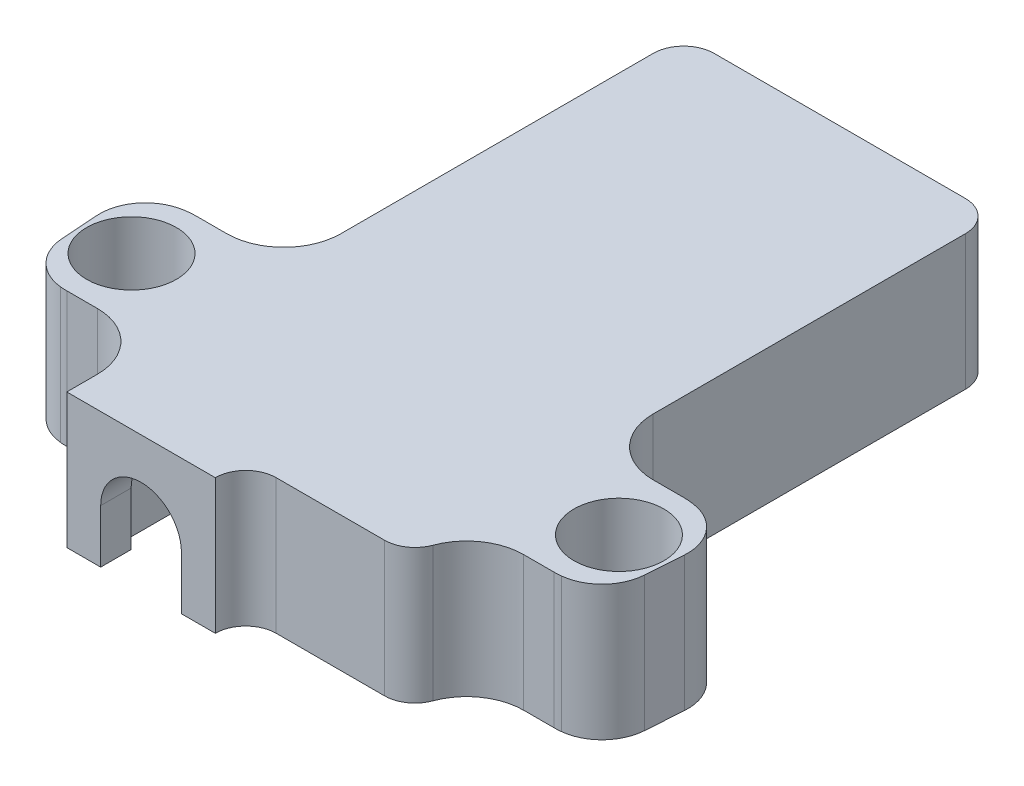
from build123d import *

# Parameters (mm, degrees)
SKETCH1_W           = 20.5
SKETCH1_H           = 38.5
SKETCH1_R           = 4.25
SKETCH1_R_2         = 1.75
BOSS_EXTRUDE1_DEPTH = 1.5
SKETCH2_W           = 20.5
SKETCH2_H           = 38.5
BOSS_EXTRUDE2_DEPTH = 7.35
SKETCH3_W           = 17.5
SKETCH3_H           = 35.5
SKETCH3_W_2         = 6.75
SKETCH3_H_2         = 1.5
CUT_EXTRUDE1_DEPTH  = 7.35
SKETCH4_W           = 7.2
SKETCH4_H           = 1.5
CUT_EXTRUDE2_DEPTH  = 4.05
SKETCH6_W           = 17.5
SKETCH6_H           = 1.5
BOSS_EXTRUDE3_DEPTH = 1.35
SKETCH7_W           = 3.5
SKETCH7_H           = 2
BOSS_EXTRUDE4_DEPTH = 1
SKETCH8_R           = 2.95
BOSS_EXTRUDE5_DEPTH = 7.35
FILLET2_R           = 3.75
CUT_EXTRUDE4_START  = -8.85
CUT_EXTRUDE4_DEPTH  = 8.85
FILLET5_R           = 3
SKETCH10_W          = 9.75
SKETCH10_H          = 2
BOSS_EXTRUDE6_DEPTH = 8.85
CUT_EXTRUDE5_REACH  = 47.729
FILLET4_R           = 2


with BuildPart() as part:
    # Sketch1 → Boss-Extrude1 (new body)
    # profile 1 of 5: a face of its own
    with BuildSketch(Plane(origin=(0, 0, 0), x_dir=(1, 0, 0), z_dir=(0, 1, 0))):
        with Locations((0, 11.25)):
            Rectangle(SKETCH1_W, SKETCH1_H)
    # profile 2 of 5: a face of its own
    with BuildSketch(Plane(origin=(0, 0, 0), x_dir=(1, 0, 0), z_dir=(0, 1, 0))):
        with BuildLine():
            Line((-10.25, -4.25), (-10.25, 4.25))
            Line((-10.25, 4.25), (-16, 4.25))
            ThreePointArc((-16, 4.25), (-12.99479618, 3.00520382), (-11.75, 0))
            ThreePointArc((-11.75, 0), (-12.99479618, -3.00520382), (-16, -4.25))
            Line((-16, -4.25), (-10.25, -4.25))
        make_face()
    # profile 3 of 5: a face of its own
    with BuildSketch(Plane(origin=(0, 0, 0), x_dir=(1, 0, 0), z_dir=(0, 1, 0))):
        with Locations((-16, 0)):
            Circle(SKETCH1_R)
        with Locations(Location((-16, 0, 0), (0, 0, 270))):
            Circle(SKETCH1_R_2, mode=Mode.SUBTRACT)
    # profile 4 of 5: a face of its own
    with BuildSketch(Plane(origin=(0, 0, 0), x_dir=(1, 0, 0), z_dir=(0, 1, 0))):
        with BuildLine():
            Line((16, 4.25), (10.25, 4.25))
            Line((10.25, 4.25), (10.25, -4.25))
            Line((10.25, -4.25), (16, -4.25))
            ThreePointArc((16, -4.25), (11.75, 0), (16, 4.25))
        make_face()
    # profile 5 of 5: a face of its own
    with BuildSketch(Plane(origin=(0, 0, 0), x_dir=(1, 0, 0), z_dir=(0, 1, 0))):
        with Locations((16, 0)):
            Circle(SKETCH1_R)
        with Locations(Location((16, 0, 0), (0, 0, 270))):
            Circle(SKETCH1_R_2, mode=Mode.SUBTRACT)
    extrude(amount=BOSS_EXTRUDE1_DEPTH)

    # Sketch2 → Boss-Extrude2 (add)
    with BuildSketch(Plane(origin=(0, 1.5, 0), x_dir=(1, 0, 0), z_dir=(0, 1, 0))):
        with Locations((0, 11.25)):
            Rectangle(SKETCH2_W, SKETCH2_H)
    extrude(amount=BOSS_EXTRUDE2_DEPTH)

    # Sketch3 → Cut-Extrude1 (cut)
    with BuildSketch(Plane.XZ):
        with Locations((0, -11.25)):
            Rectangle(SKETCH3_W, SKETCH3_H)
        with Locations((-5.375, 7.25)):
            Rectangle(SKETCH3_W_2, SKETCH3_H_2)
    extrude(amount=-CUT_EXTRUDE1_DEPTH, mode=Mode.SUBTRACT)

    # Sketch4 → Cut-Extrude2 (cut)
    with BuildSketch(Plane.XZ):
        with Locations((-2.85, -29.75)):
            Rectangle(SKETCH4_W, SKETCH4_H)
    extrude(amount=-CUT_EXTRUDE2_DEPTH, mode=Mode.SUBTRACT)

    # Sketch6 → Boss-Extrude3 (add)
    with BuildSketch(Plane.XZ.offset(-7.35)):
        with Locations((0, -28.25)):
            Rectangle(SKETCH6_W, SKETCH6_H)
    extrude(amount=BOSS_EXTRUDE3_DEPTH)

    # Sketch7 → Boss-Extrude4 (add)
    with BuildSketch(Plane.XY.offset(-29)):
        with Locations((7, 3.25)):
            Rectangle(SKETCH7_W, SKETCH7_H)
    extrude(amount=BOSS_EXTRUDE4_DEPTH)

    # Sketch8 → Boss-Extrude5 (add)
    # profile 1 of 2: a face of its own
    with BuildSketch(Plane(origin=(0, 1.5, 0), x_dir=(1, 0, 0), z_dir=(0, 1, 0))):
        with BuildLine():
            Line((-10.25, -4.25), (-10.25, 4.25))
            Line((-10.25, 4.25), (-16, 4.25))
            ThreePointArc((-16, 4.25), (-20.25, 0), (-16, -4.25))
            Line((-16, -4.25), (-10.25, -4.25))
        make_face()
        with Locations(Location((-16, 0, 0), (0, 0, 270))):
            Circle(SKETCH8_R, mode=Mode.SUBTRACT)
    # profile 2 of 2: a face of its own
    with BuildSketch(Plane(origin=(0, 1.5, 0), x_dir=(1, 0, 0), z_dir=(0, 1, 0))):
        with BuildLine():
            Line((10.25, 4.25), (10.25, -4.25))
            Line((10.25, -4.25), (16, -4.25))
            ThreePointArc((16, -4.25), (20.25, 0), (16, 4.25))
            Line((16, 4.25), (10.25, 4.25))
        make_face()
        with Locations(Location((16, 0, 0), (0, 0, 270))):
            Circle(SKETCH8_R, mode=Mode.SUBTRACT)
    extrude(amount=BOSS_EXTRUDE5_DEPTH)

    # Fillet2
    fillet2_edges = [part.edges().sort_by_distance(p)[0] for p in [
        (10.25, 4.425, -4.25),
        (10.25, 4.425, 4.25),
        (-10.25, 4.425, 4.25),
        (-10.25, 4.425, -4.25),
    ]]
    fillet(fillet2_edges, radius=FILLET2_R - 0.0001)  # a hair under: the kernel refuses the full size

    # Sketch9 → Cut-Extrude4 (cut)
    with BuildSketch(Plane(origin=(0, 8.85, 0), x_dir=(1, 0, 0), z_dir=(0, 1, 0)).offset(CUT_EXTRUDE4_START)):
        with BuildLine():
            Line((-24.982948352, 53.686308531), (-20.952771504, -3.947905519))
            ThreePointArc((-20.952771504, -3.947905519), (-19.171836931, -8.143524448), (-15.185360396, -10.353264474))
            Line((-15.185360396, -10.353264474), (-1.215537244, -12.816521212))
            ThreePointArc((-1.215537244, -12.816521212), (0, -12.922866941), (1.215537244, -12.816521212))
            Line((1.215537244, -12.816521212), (15.185360396, -10.353264474))
            ThreePointArc((15.185360396, -10.353264474), (19.171836931, -8.143524448), (20.952771504, -3.947905519))
            Line((20.952771504, -3.947905519), (24.982948352, 53.686308531))
            ThreePointArc((24.982948352, 53.686308531), (24.995735789, 53.930307371), (25, 54.174603847))
            Line((25, 54.174603847), (25, 107.825396153))
            ThreePointArc((25, 107.825396153), (24.995735789, 108.069692629), (24.982948352, 108.313691469))
            Line((24.982948352, 108.313691469), (20.952771504, 165.947905519))
            ThreePointArc((20.952771504, 165.947905519), (19.171836931, 170.143524448), (15.185360396, 172.353264474))
            Line((15.185360396, 172.353264474), (1.215537244, 174.816521212))
            ThreePointArc((1.215537244, 174.816521212), (0, 174.922866941), (-1.215537244, 174.816521212))
            Line((-1.215537244, 174.816521212), (-15.185360396, 172.353264474))
            ThreePointArc((-15.185360396, 172.353264474), (-19.171836931, 170.143524448), (-20.952771504, 165.947905519))
            Line((-20.952771504, 165.947905519), (-24.982948352, 108.313691469))
            ThreePointArc((-24.982948352, 108.313691469), (-24.995735789, 108.069692629), (-25, 107.825396153))
            Line((-25, 107.825396153), (-25, 54.174603847))
            ThreePointArc((-25, 54.174603847), (-24.995735789, 53.930307371), (-24.982948352, 53.686308531))
        make_face()
        with BuildLine():
            Line((-18.957643404, 165.808392572), (-22.987820251, 108.174178521))
            ThreePointArc((-22.987820251, 108.174178521), (-22.996954135, 107.999893636), (-23, 107.825396153))
            Line((-23, 107.825396153), (-23, 54.174603847))
            ThreePointArc((-23, 54.174603847), (-22.996954135, 54.000106364), (-22.987820251, 53.825821479))
            Line((-22.987820251, 53.825821479), (-18.957643404, -3.808392572))
            ThreePointArc((-18.957643404, -3.808392572), (-17.68554728, -6.805263235), (-14.838064041, -8.383648968))
            Line((-14.838064041, -8.383648968), (-0.868240888, -10.846905706))
            ThreePointArc((-0.868240888, -10.846905706), (0, -10.922866941), (0.868240888, -10.846905706))
            Line((0.868240888, -10.846905706), (14.838064041, -8.383648968))
            ThreePointArc((14.838064041, -8.383648968), (17.68554728, -6.805263235), (18.957643404, -3.808392572))
            Line((18.957643404, -3.808392572), (22.987820251, 53.825821479))
            ThreePointArc((22.987820251, 53.825821479), (22.996954135, 54.000106364), (23, 54.174603847))
            Line((23, 54.174603847), (23, 107.825396153))
            ThreePointArc((23, 107.825396153), (22.996954135, 107.999893636), (22.987820251, 108.174178521))
            Line((22.987820251, 108.174178521), (18.957643404, 165.808392572))
            ThreePointArc((18.957643404, 165.808392572), (17.68554728, 168.805263235), (14.838064041, 170.383648968))
            Line((14.838064041, 170.383648968), (0.868240888, 172.846905706))
            ThreePointArc((0.868240888, 172.846905706), (0, 172.922866941), (-0.868240888, 172.846905706))
            Line((-0.868240888, 172.846905706), (-14.838064041, 170.383648968))
            ThreePointArc((-14.838064041, 170.383648968), (-17.68554728, 168.805263235), (-18.957643404, 165.808392572))
        make_face(mode=Mode.SUBTRACT)
    extrude(amount=CUT_EXTRUDE4_DEPTH, mode=Mode.SUBTRACT)

    # Fillet5
    fillet5_edges = [part.edges().sort_by_distance(p)[0] for p in [
        (-19.402072162, 4.425, -2.547234776),
        (-19.014456867, 4.425, 2.995922195),
        (19.014456867, 4.425, 2.995922195),
        (19.402072162, 4.425, -2.547234776),
    ]]
    fillet(fillet5_edges, radius=FILLET5_R)

    # Sketch10 → Boss-Extrude6 (add)
    with BuildSketch(Plane(origin=(0, 0, 0), x_dir=(1, 0, 0), z_dir=(0, 1, 0))):
        with Locations((-5.375, -9)):
            Rectangle(SKETCH10_W, SKETCH10_H)
    extrude(amount=BOSS_EXTRUDE6_DEPTH)

    # Sketch11 → Cut-Extrude5 (cut, up to next)
    with BuildSketch(Plane.XY.offset(10), mode=Mode.PRIVATE) as cut_extrude5_sk1:
        with BuildLine():
            ThreePointArc((-2.725, 3.5), (-3.50116703, 5.37383297), (-5.375, 6.15))
            Line((-5.375, 6.15), (-5.375, 0.85))
            ThreePointArc((-5.375, 0.85), (-3.50116703, 1.62616703), (-2.725, 3.5))
        make_face()
    cut_extrude5_tool1 = extrude(cut_extrude5_sk1.sketch, amount=-CUT_EXTRUDE5_REACH, mode=Mode.PRIVATE) & part.part
    # Sketch11 → Cut-Extrude5 (cut, up to next)
    with BuildSketch(Plane.XY.offset(10), mode=Mode.PRIVATE) as cut_extrude5_sk2:
        with BuildLine():
            Line((-5.375, 0.85), (-5.375, 6.15))
            ThreePointArc((-5.375, 6.15), (-7.24883297, 5.37383297), (-8.025, 3.5))
            ThreePointArc((-8.025, 3.5), (-7.24883297, 1.62616703), (-5.375, 0.85))
        make_face()
    cut_extrude5_tool2 = extrude(cut_extrude5_sk2.sketch, amount=-CUT_EXTRUDE5_REACH, mode=Mode.PRIVATE) & part.part
    # Sketch11 → Cut-Extrude5 (cut, up to next)
    with BuildSketch(Plane.XY.offset(10), mode=Mode.PRIVATE) as cut_extrude5_sk3:
        with BuildLine():
            ThreePointArc((-2.725, 3.5), (-3.50116703, 5.37383297), (-5.375, 6.15))
            Line((-5.375, 6.15), (-5.375, 0.85))
            ThreePointArc((-5.375, 0.85), (-3.50116703, 1.62616703), (-2.725, 3.5))
        make_face()
    cut_extrude5_tool3 = extrude(cut_extrude5_sk3.sketch, amount=-CUT_EXTRUDE5_REACH, mode=Mode.PRIVATE) & part.part
    # Sketch11 → Cut-Extrude5 (cut, up to next)
    with BuildSketch(Plane.XY.offset(10), mode=Mode.PRIVATE) as cut_extrude5_sk4:
        with BuildLine():
            Line((-5.375, 0.85), (-5.375, 6.15))
            ThreePointArc((-5.375, 6.15), (-7.24883297, 5.37383297), (-8.025, 3.5))
            ThreePointArc((-8.025, 3.5), (-7.24883297, 1.62616703), (-5.375, 0.85))
        make_face()
    cut_extrude5_tool4 = extrude(cut_extrude5_sk4.sketch, amount=-CUT_EXTRUDE5_REACH, mode=Mode.PRIVATE) & part.part
    # Sketch11 → Cut-Extrude5 (cut, up to next)
    with BuildSketch(Plane.XY.offset(10), mode=Mode.PRIVATE) as cut_extrude5_sk5:
        with BuildLine():
            Line((-5.375, 0), (-5.375, 0.85))
            ThreePointArc((-5.375, 0.85), (-7.24883297, 1.62616703), (-8.025, 3.5))
            Line((-8.025, 3.5), (-8.025, 0))
            Line((-8.025, 0), (-5.375, 0))
        make_face()
    cut_extrude5_tool5 = extrude(cut_extrude5_sk5.sketch, amount=-CUT_EXTRUDE5_REACH, mode=Mode.PRIVATE) & part.part
    # Sketch11 → Cut-Extrude5 (cut, up to next)
    with BuildSketch(Plane.XY.offset(10), mode=Mode.PRIVATE) as cut_extrude5_sk6:
        with BuildLine():
            ThreePointArc((-2.725, 3.5), (-3.50116703, 1.62616703), (-5.375, 0.85))
            Line((-5.375, 0.85), (-5.375, 0))
            Line((-5.375, 0), (-2.725, 0))
            Line((-2.725, 0), (-2.725, 3.5))
        make_face()
    cut_extrude5_tool6 = extrude(cut_extrude5_sk6.sketch, amount=-CUT_EXTRUDE5_REACH, mode=Mode.PRIVATE) & part.part
    add(cut_extrude5_tool1.solids().sort_by_distance((-4.250305, 3.5, 10))[0], mode=Mode.SUBTRACT)
    add(cut_extrude5_tool2.solids().sort_by_distance((-6.499695, 3.5, 10))[0], mode=Mode.SUBTRACT)
    add(cut_extrude5_tool3.solids().sort_by_distance((-4.250305, 3.5, 10))[0], mode=Mode.SUBTRACT)
    add(cut_extrude5_tool4.solids().sort_by_distance((-6.499695, 3.5, 10))[0], mode=Mode.SUBTRACT)
    add(cut_extrude5_tool5.solids().sort_by_distance((-6.993859, 0.832642, 10))[0], mode=Mode.SUBTRACT)
    add(cut_extrude5_tool6.solids().sort_by_distance((-3.756141, 0.832642, 10))[0], mode=Mode.SUBTRACT)

    # Fillet4
    fillet4_edges = [part.edges().sort_by_distance(p)[0] for p in [
        (10.25, 4.425, 8),
        (10.25, 4.425, -30.5),
        (-10.25, 4.425, -30.5),
        (-0.5, 4.425, 8),
    ]]
    fillet(fillet4_edges, radius=FILLET4_R - 0.0001)  # a hair under: the kernel refuses the full size


solid = part.part
